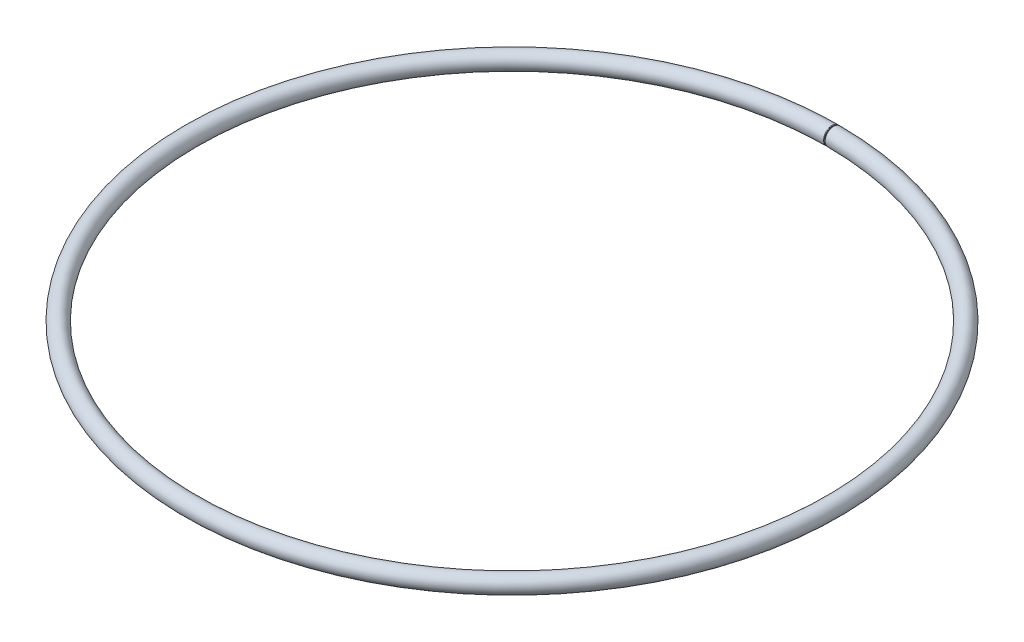
from build123d import *

# Parameters (mm, degrees)
SKETCH2_R               = 9.75
SKETCH2_R_2             = 8.25
CUT_EXTRUDE1_DEPTH      = 10
CUT_EXTRUDE1_DEPTH_BACK = 10
FILLET1_R               = 0.5


with BuildPart() as part:
    # Sketch2 → Revolve1 (revolve)
    with BuildSketch(Plane(origin=(0, 0, 0), x_dir=(0, 0, -1), z_dir=(1, 0, 0))):
        with Locations((-362.75, 0)):
            Circle(SKETCH2_R)
        with Locations((-362.75, 0)):
            Circle(SKETCH2_R_2, mode=Mode.SUBTRACT)
    revolve(axis=Axis((0, 0, 0), (0, 1, 0)))

    # Sketch3 → Cut-Extrude1 (cut, two sides: drawn at the far end of the back side and taken through both)
    with BuildSketch(Plane(origin=(0, 0, 0), x_dir=(1, 0, 0), z_dir=(0, 1, 0)).offset(-CUT_EXTRUDE1_DEPTH_BACK)):
        Polygon((0, 373.506607592), (0.5, 373.506607592), (0.5, 352.729632285), (-0.5, 352.729632285), (-0.5, 373.506607592), align=None)
    extrude(amount=CUT_EXTRUDE1_DEPTH + CUT_EXTRUDE1_DEPTH_BACK, mode=Mode.SUBTRACT)

    # Fillet1
    fillet1_edges = [part.edges().sort_by_distance(p)[0] for p in [
        (0.5, 0, -372.499664429),
        (-0.5, 0, -372.499664429),
        (0.5, 0, -370.999663073),
        (-0.5, 0, -370.999663073),
    ]]
    fillet(fillet1_edges, radius=FILLET1_R)


solid = part.part
